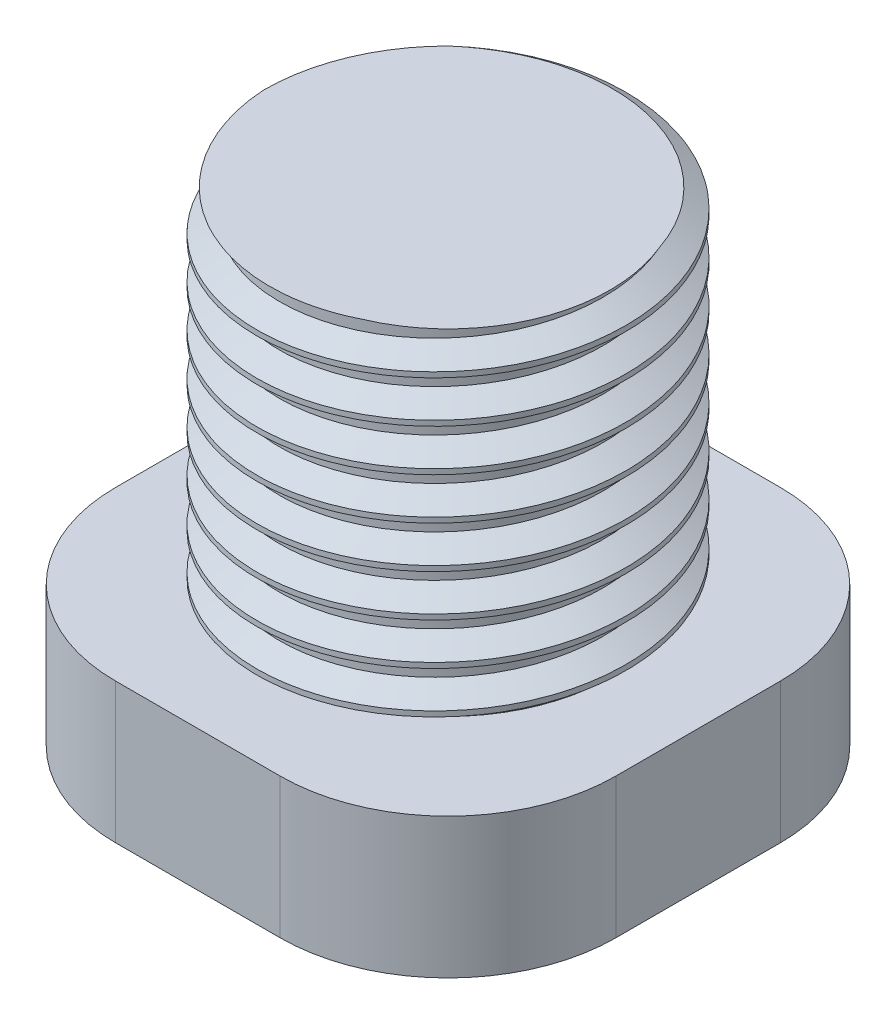
from build123d import *

# Parameters (mm, degrees)
SKETCH2_R           = 11
BOSS_EXTRUDE1_DEPTH = 20
SKETCH35_W          = 29.8
SKETCH35_H          = 29.8
BOSS_EXTRUDE2_DEPTH = 8.35
THREAD3_PITCH       = 2.5
THREAD3_TO          = 25
FILLET1_R           = 10
SKETCH36_R          = 2.125
CUT_EXTRUDE1_DEPTH  = 5


with BuildPart() as part:
    # Sketch2 → Boss-Extrude1 (new body)
    with BuildSketch(Plane(origin=(0, 0, 0), x_dir=(1, 0, 0), z_dir=(0, 1, 0))):
        with Locations(Location((0, 0, 0), (0, 0, 270))):
            Circle(SKETCH2_R)
    extrude(amount=BOSS_EXTRUDE1_DEPTH)

    # Sketch35 → Boss-Extrude2 (add)
    with BuildSketch(Plane(origin=(0, 0, 0), x_dir=(1, 0, 0), z_dir=(0, 1, 0))):
        Rectangle(SKETCH35_W, SKETCH35_H)
    extrude(amount=-BOSS_EXTRUDE2_DEPTH)

    # Thread3: arcs per turn and ends read off the stored shape
    # Thread3: the profile of Thread Profile3 profile screwed along a right-hand helix through 10 turns, 10 arcs to a turn; built about Z, then put on its axis
    thread3_z = Axis((0, 0, 0), (0, 0, 1))
    thread3_corners = [(11.0003, 0, -0.000173205), (11.0003, 0, 2.187673198), (9.646835313, 0, 1.406249997), (9.646835313, 0, 0.781249997)]
    with BuildLine(mode=Mode.PRIVATE) as thread3_profile:
        Line(thread3_corners[0], thread3_corners[1])
        Line(thread3_corners[1], thread3_corners[2])
        Line(thread3_corners[2], thread3_corners[3])
        Line(thread3_corners[3], thread3_corners[0])
    thread3_cap = Face(thread3_profile.wire())
    thread3_turn_angles = [0, 18, 36, 54, 72, 90, 108, 126, 144, 162, 180, 198, 216, 234, 252, 270, 288, 306, 324, 342, 360]
    thread3_turn_weights = [1, 0.9510565162951535, 1, 0.9510565162951535, 1, 0.9510565162951535, 1, 0.9510565162951535, 1, 0.9510565162951535, 1, 0.9510565162951535, 1, 0.9510565162951535, 1, 0.9510565162951535, 1, 0.9510565162951535, 1, 0.9510565162951535, 1]
    thread3_turn_rails = [Edge.make_bspline([Vector(p[0], p[1], 0).rotate(thread3_z, thread3_turn_angles[k]) / thread3_turn_weights[k] + Vector(0, 0, p[2] + THREAD3_PITCH * thread3_turn_angles[k] / 360) for k in range(21)], [0, 0, 0, 1, 1, 2, 2, 3, 3, 4, 4, 5, 5, 6, 6, 7, 7, 8, 8, 9, 9, 10, 10, 10], 2, thread3_turn_weights) for p in thread3_corners]
    thread3_turn_sides = [Face.make_surface_from_curves(thread3_turn_rails[p[0]], thread3_turn_rails[p[1]]) for p in [(0, 1), (1, 2), (2, 3), (3, 0)]]
    thread3 = Plane(origin=(0, 25, 0), x_dir=(-1, 0, 0), z_dir=(0, -1, 0)) * split(Solid(Shell([*[p.moved(Location((0, 0, THREAD3_PITCH * i))) for i in range(10) for p in thread3_turn_sides], thread3_cap, thread3_cap.rotate(thread3_z, 3600).moved(Location((0, 0, THREAD3_PITCH * 3600 / 360)))])), bisect_by=Plane.XY.offset(THREAD3_TO), keep=Keep.BOTTOM, mode=Mode.PRIVATE)
    add(thread3, mode=Mode.SUBTRACT)

    # Fillet1
    fillet1_edges = [part.edges().sort_by_distance(p)[0] for p in [
        (-14.9, -4.175, 14.9),
        (-14.9, -4.175, -14.9),
        (14.9, -4.175, -14.9),
        (14.9, -4.175, 14.9),
    ]]
    fillet(fillet1_edges, radius=FILLET1_R)

    # Sketch36 → Cut-Extrude1 (cut)
    with BuildSketch(Plane.XZ.offset(8.35)):
        with Locations(Location((0, 0, 0), (0, 0, 270))):
            Circle(SKETCH36_R)
    extrude(amount=-CUT_EXTRUDE1_DEPTH, mode=Mode.SUBTRACT)


solid = part.part
